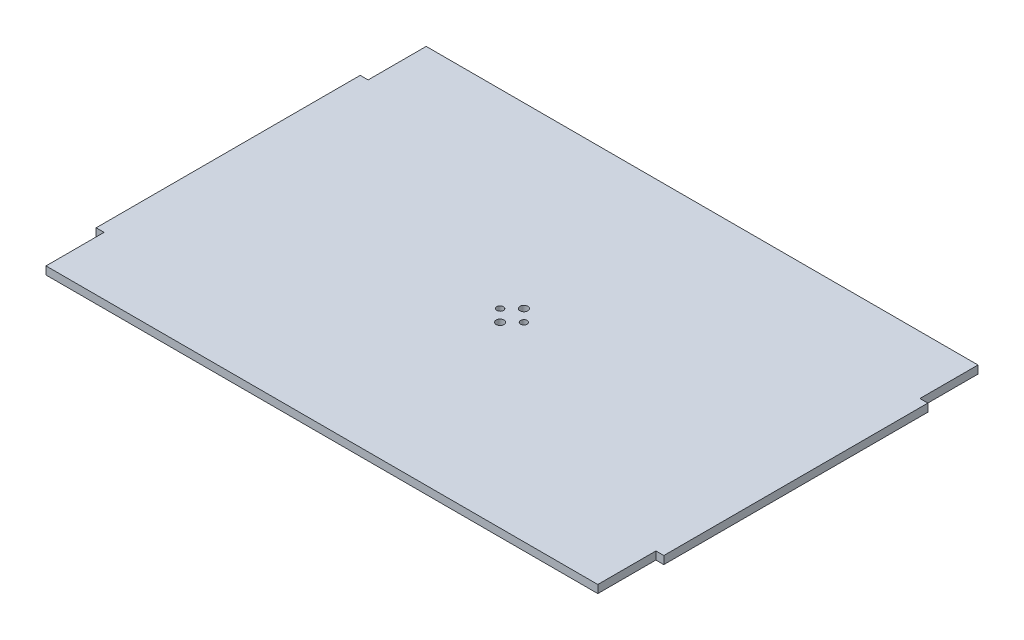
from build123d import *

# Parameters (mm, degrees)
BOSS_EXTRUDE1_DEPTH = 6
SKETCH2_R           = 3
SKETCH2_R_2         = 2.5
CUT_EXTRUDE1_DEPTH  = 6


with BuildPart() as part:
    # Sketch1 → Boss-Extrude1 (new body)
    with BuildSketch(Plane(origin=(0, 0, 0), x_dir=(1, 0, 0), z_dir=(0, 1, 0))):
        Polygon((418, 244), (424, 244), (424, 44), (418, 44), (418, 0), (0, 0), (0, 44), (-6, 44), (-6, 244), (0, 244), (0, 288), (418, 288), align=None)
    extrude(amount=BOSS_EXTRUDE1_DEPTH)

    # Sketch2 → Cut-Extrude1 (cut)
    with BuildSketch(Plane(origin=(0, 6, 0), x_dir=(1, 0, 0), z_dir=(0, 1, 0))):
        with Locations((209, 135)):
            Circle(SKETCH2_R)
        with Locations((209, 153)):
            Circle(SKETCH2_R)
        with Locations((200, 144)):
            Circle(SKETCH2_R_2)
        with Locations((218, 144)):
            Circle(SKETCH2_R_2)
    extrude(amount=-CUT_EXTRUDE1_DEPTH, mode=Mode.SUBTRACT)


solid = part.part
